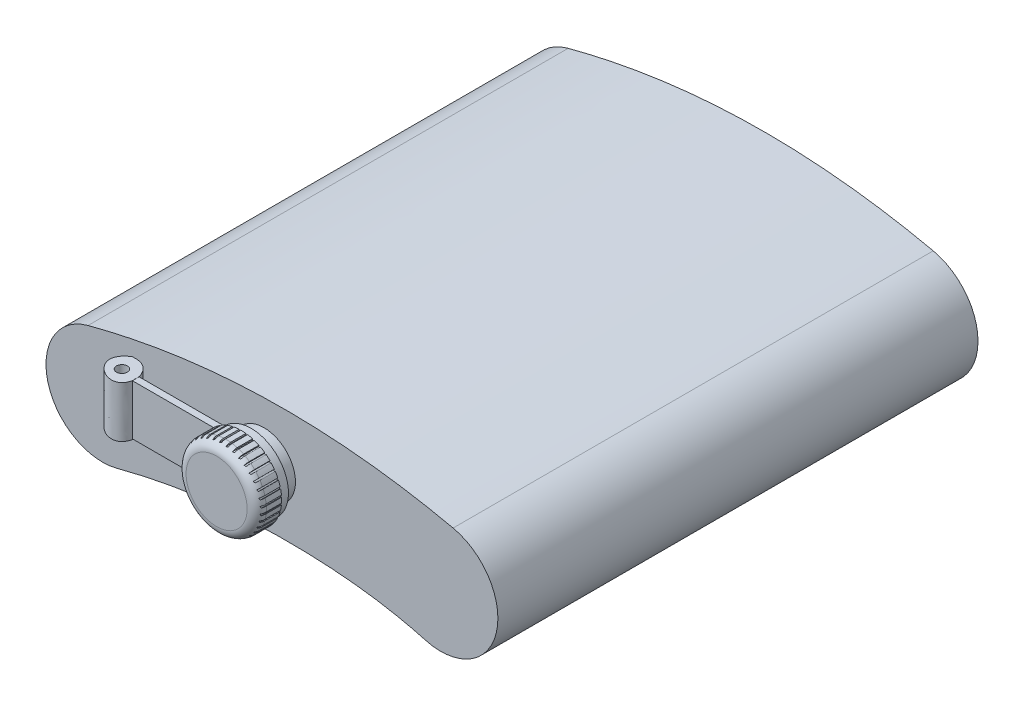
from build123d import *

# Parameters (mm, degrees)
BOSS_EXTRUDE1_DEPTH      = 635
SKETCH2_R                = 41.565118026
BOSS_EXTRUDE2_DEPTH      = 17.018
SKETCH3_R                = 49.338707078
BOSS_EXTRUDE3_DEPTH      = 12.7
SKETCH4_R                = 53.072998168
BOSS_EXTRUDE4_DEPTH      = 26.924
SKETCH6_W                = 2.199389172
SKETCH6_H                = 26.924
CUT_EXTRUDE1_DEPTH       = 252.73
CIRPATTERN1_COUNT        = 37
SKETCH8_R                = 53.072998168
BOSS_EXTRUDE5_DEPTH      = 6.096
FILLET1_R                = 12.7
SKETCH9_W                = 8.880990223
SKETCH9_H                = 66.607426671
BOSS_EXTRUDE6_DEPTH      = 402.082
SKETCH11_W               = 304.653820792
SKETCH11_H               = 223.659508431
CUT_EXTRUDE2_DEPTH       = 17.78
BOSS_EXTRUDE7_DEPTH      = 0.762
BOSS_EXTRUDE7_DEPTH_BACK = 66.802
SKETCH13_R               = 7.203911694
CUT_EXTRUDE3_DEPTH       = 81.28


with BuildPart() as part:
    # Sketch1 → Boss-Extrude1 (new body)
    with BuildSketch(Plane.XY):
        with BuildLine():
            ThreePointArc((193.435050077, 345.290150179), (140.336854143, 253.921297535), (231.705706788, 200.823101601))
            add(Edge.make_bspline(
                [(231.705706788, 200.823101601), (319.03548732, 223.957567794), (454.715193716, 237.65780701), (591.136459106, 221.520638174), (639.636432781, 208.027521255)],
                knots=[0, 0, 0, 0, 0.638604127, 1, 1, 1, 1], degree=3))
            ThreePointArc((639.636432781, 208.027521255), (733.292071352, 262.550783601), (676.324279709, 354.739912505))
            add(Edge.make_bspline(
                [(676.324279709, 354.739912505), (610.418204719, 369.390310224), (449.537559901, 389.095231292), (288.420462981, 370.452664161), (193.435050077, 345.290150179)],
                knots=[0, 0, 0, 0, 0.409672869, 1, 1, 1, 1], degree=3))
        make_face()
    extrude(amount=BOSS_EXTRUDE1_DEPTH)

    # Sketch2 → Boss-Extrude2 (add)
    with BuildSketch(Plane.XY.offset(635)):
        with Locations((426.230487536, 303.079974585)):
            Circle(SKETCH2_R)
    extrude(amount=BOSS_EXTRUDE2_DEPTH)

    # Sketch3 → Boss-Extrude3 (add)
    with BuildSketch(Plane.XY.offset(652.018)):
        with Locations(Location((426.230487536, 303.079974585, 0), (0, 0, 180))):
            Circle(SKETCH3_R)
    extrude(amount=BOSS_EXTRUDE3_DEPTH)

    # Sketch4 → Boss-Extrude4 (add)
    with BuildSketch(Plane.XY.offset(664.718)):
        with Locations((426.230487536, 303.079974585)):
            Circle(SKETCH4_R)
    extrude(amount=BOSS_EXTRUDE4_DEPTH)

    # Sketch6 → Cut-Extrude1 (cut)
    with BuildSketch(Plane(origin=(0, 0, 0), x_dir=(1, 0, 0), z_dir=(0, 1, 0))):
        with Locations((414.939161023, -678.18)):
            Rectangle(SKETCH6_W, SKETCH6_H)
    cut_extrude1 = extrude(amount=CUT_EXTRUDE1_DEPTH, mode=Mode.SUBTRACT)

    # CirPattern1: Cut-Extrude1 ×37 about axis
    cirpattern1_axis = Axis((426.230487536, 303.079974585, 0), (0, 0, 1))
    for i in range(1, CIRPATTERN1_COUNT):
        add(cut_extrude1.rotate(cirpattern1_axis, i * 360 / CIRPATTERN1_COUNT), mode=Mode.SUBTRACT)

    # Sketch8 → Boss-Extrude5 (add)
    with BuildSketch(Plane.XY.offset(691.642)):
        with Locations(Location((426.230487536, 303.079974585, 0), (0, 0, 181.090859226))):
            Circle(SKETCH8_R)
    extrude(amount=BOSS_EXTRUDE5_DEPTH)

    # Fillet1
    # the kernel refuses this fillet: 12.7 mm, written as the material it takes off along each edge
    with BuildSketch(Plane(origin=(426.230487536, 303.079974585, 697.738), x_dir=(-0.9998187620927494, -0.01903793495424113, 0), z_dir=(-0.01903793495424113, 0.9998187620927494, 0))) as fillet1_piece_1:
        with BuildLine():
            CenterArc((53.072998168 - FILLET1_R, -FILLET1_R), FILLET1_R, 0, 90)
            Line((53.072998168 - FILLET1_R, 0), (53.072998168, 0))
            Line((53.072998168, 0), (53.072998168, -FILLET1_R))
        make_face()
    revolve(axis=Axis((426.230487536, 303.079974585, 697.738), (0, 0, 1)), mode=Mode.SUBTRACT)

    # Sketch9 → Boss-Extrude6 (add)
    with BuildSketch(Plane(origin=(0, 0, 0), x_dir=(0, 0, -1), z_dir=(1, 0, 0))):
        with Locations((-657.871395655, 305.414235749)):
            Rectangle(SKETCH9_W, SKETCH9_H)
    extrude(amount=BOSS_EXTRUDE6_DEPTH)

    # Sketch11 → Cut-Extrude2 (cut)
    with BuildSketch(Plane.XY.offset(662.311890766)):
        with Locations((127.187681637, 323.90707289)):
            Rectangle(SKETCH11_W, SKETCH11_H)
    extrude(amount=-CUT_EXTRUDE2_DEPTH, mode=Mode.SUBTRACT)

    # Sketch12 → Boss-Extrude7 (add, two sides: drawn at the far end of the back side and taken through both)
    with BuildSketch(Plane(origin=(0, 272.110522413, 0), x_dir=(-1, 0, 0), z_dir=(0, -1, 0)).offset(-BOSS_EXTRUDE7_DEPTH_BACK)):
        with BuildLine():
            Line((-279.514592033, -662.311890766), (-279.514592033, -653.430900543))
            add(Edge.make_bspline(
                [(-252.171562033, -635), (-273.248108178, -633.224660121), (-279.514592033, -653.430900543)],
                knots=[0, 0, 0, 1, 1, 1], degree=2))
            add(Edge.make_bspline(
                [(-279.514592033, -662.311890766), (-272.790078489, -695.578847654), (-215.630884772, -657.7836819), (-252.171562033, -635)],
                knots=[0, 0, 0, 0, 1, 1, 1, 1], degree=3))
        make_face()
    extrude(amount=BOSS_EXTRUDE7_DEPTH + BOSS_EXTRUDE7_DEPTH_BACK)

    # Sketch13 → Cut-Extrude3 (cut)
    with BuildSketch(Plane(origin=(0, 271.348522413, 0), x_dir=(-1, 0, 0), z_dir=(0, -1, 0))):
        with Locations(Location((-259.313862911, -656.071474204, 0), (0, 0, 90))):
            Circle(SKETCH13_R)
    extrude(amount=-CUT_EXTRUDE3_DEPTH, mode=Mode.SUBTRACT)


solid = part.part
